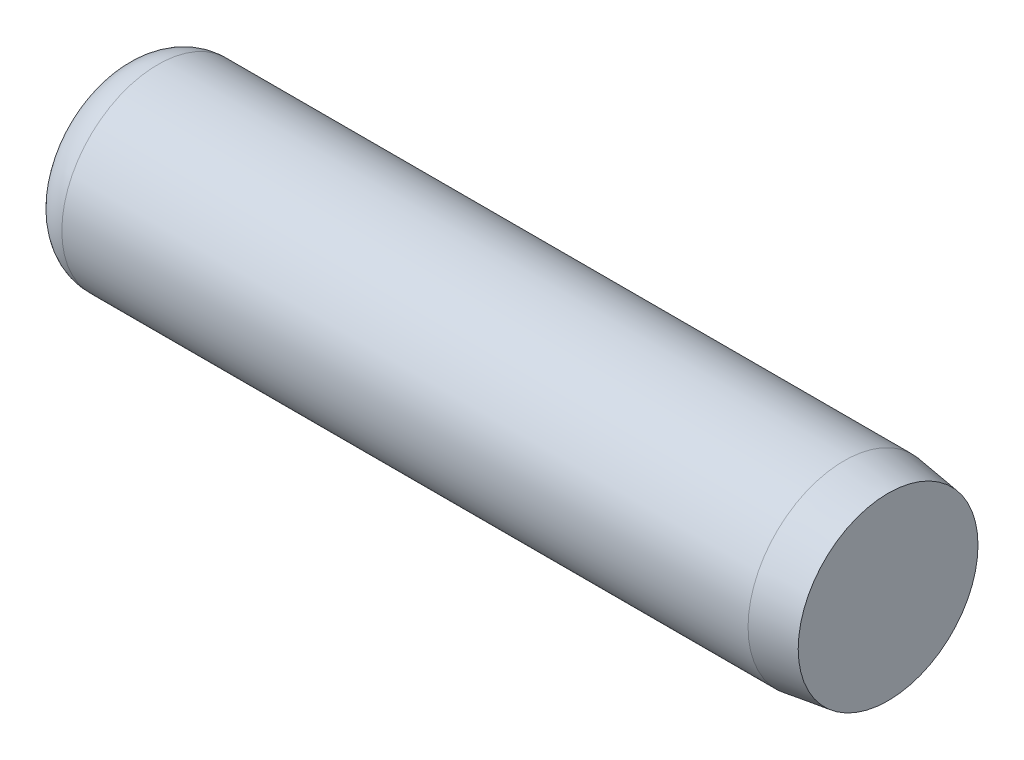
from build123d import *


with BuildPart() as part:
    # Sketch1 → Base-Revolve (revolve)
    with BuildSketch(Plane.XY):
        with BuildLine():
            Line((0, 0), (101.6, 0))
            Line((101.6, 0), (101.6, 11.883290813))
            Line((101.6, 11.883290813), (95.788812179, 12.7))
            Line((95.788812179, 12.7), (5.08, 12.7))
            ThreePointArc((5.08, 12.7), (1.487897552, 11.212102448), (0, 7.62))
            Line((0, 7.62), (0, 0))
        make_face()
    revolve(axis=Axis((-6.35, 0, 0), (1, 0, 0)))


solid = part.part
